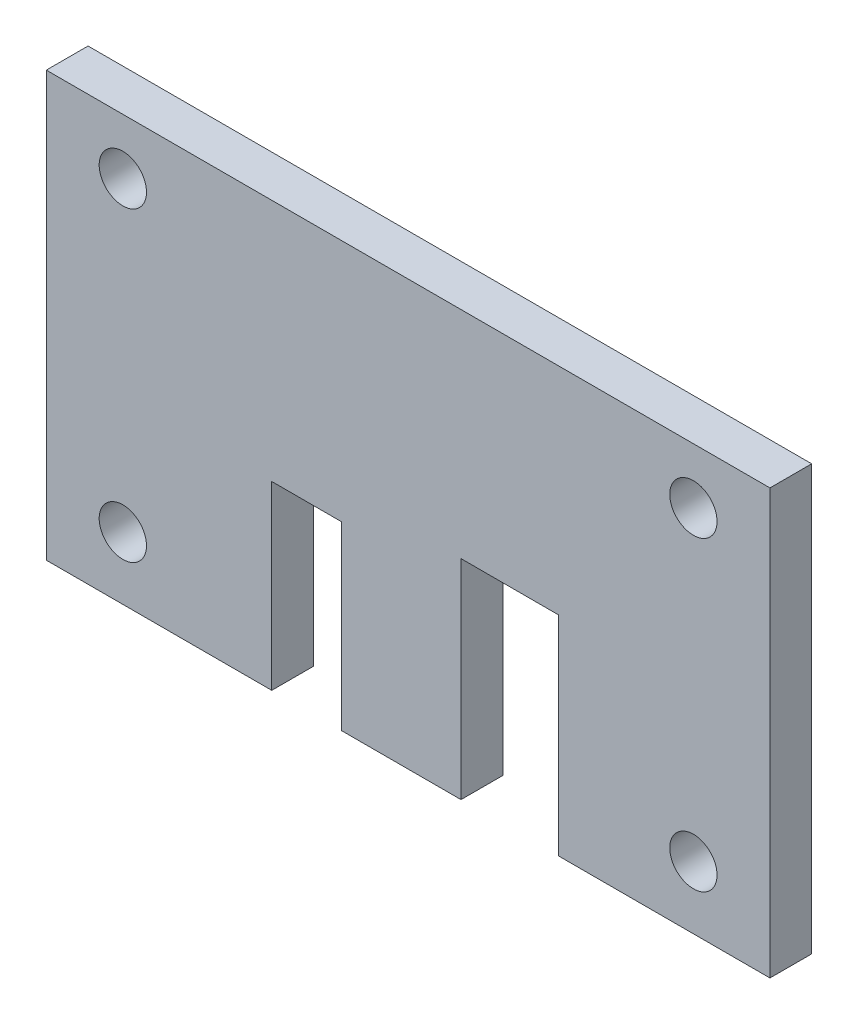
from build123d import *

# Parameters (mm, degrees)
SKETCH1_W           = 52
SKETCH1_H           = 30.5
COVER_PLATE_DEPTH   = 3
SKETCH2_W           = 5
SKETCH2_H           = 14
SKETCH2_W_2         = 7
SKETCH2_H_2         = 16
CABLE_NOTCHES_DEPTH = 5
SKETCH3_R           = 1.7
SCREW_HOLES_DEPTH   = 5


with BuildPart() as part:
    # Sketch1 → Cover Plate (new body)
    with BuildSketch(Plane.XY.offset(124.4)):
        with Locations((-36.5, -8.75)):
            Rectangle(SKETCH1_W, SKETCH1_H)
    extrude(amount=COVER_PLATE_DEPTH)

    # Sketch2 → Cable Notches (cut)
    with BuildSketch(Plane.XY.offset(123.4)):
        with Locations((-43.8, -18)):
            Rectangle(SKETCH2_W, SKETCH2_H)
        with Locations((-29.2, -17)):
            Rectangle(SKETCH2_W_2, SKETCH2_H_2)
    extrude(amount=CABLE_NOTCHES_DEPTH, mode=Mode.SUBTRACT)

    # Sketch3 → Screw Holes (cut)
    with BuildSketch(Plane.XY.offset(123.4)):
        with Locations((-57, -19.5)):
            Circle(SKETCH3_R)
        with Locations((-57, 2.5)):
            Circle(SKETCH3_R)
        with Locations((-16, -19.5)):
            Circle(SKETCH3_R)
        with Locations((-16, 2.5)):
            Circle(SKETCH3_R)
    extrude(amount=SCREW_HOLES_DEPTH, mode=Mode.SUBTRACT)


solid = part.part
